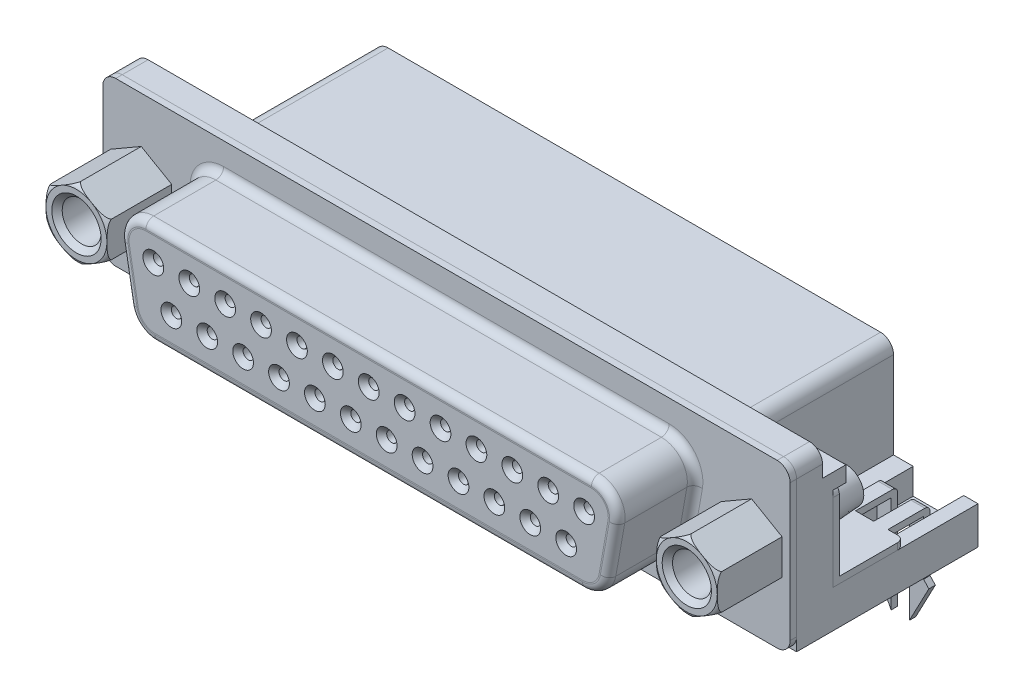
from build123d import *

# Parameters (mm, degrees)
EXTRUIR1_DEPTH         = 0.5
EXTRUIR2_DEPTH         = 6
CORTAR_EXTRUIR1_DEPTH  = 6
REDONDEO1_R            = 0.6
CROQUIS5_R             = 0.4
EXTRUIR3_DEPTH         = 6
CHAFL_N1_SIZE          = 0.4
CROQUIS6_R             = 1.6
CORTAR_EXTRUIR2_DEPTH  = 6
EXTRUIR4_DEPTH         = 5
CROQUIS9_R             = 1.5
CORTAR_EXTRUIR3_DEPTH  = 4
CHAFL_N2_SIZE          = 0.4
EXTRUIR5_DEPTH         = 14
CORTAR_EXTRUIR4_DEPTH  = 12
REDONDEO2_R            = 1
EXTRUIR6_DEPTH         = 53.04
CROQUIS13_W            = 3.9
CROQUIS13_H            = 13.996987952
CORTAR_EXTRUIR5_DEPTH  = 2
CROQUIS14_W            = 39.5
CROQUIS14_H            = 13.668273092
CORTAR_EXTRUIR6_DEPTH  = 0.6
EXTRUIR7_DEPTH         = 4.4
EXTRUIR7_DEPTH_BACK    = 2
CROQUIS15_W            = 0.7
CROQUIS15_H            = 0.7
EXTRUIR7_2_DEPTH       = 4.4
EXTRUIR7_2_DEPTH_BACK  = 2
EXTRUIR7_3_DEPTH       = 4.4
EXTRUIR7_3_DEPTH_BACK  = 2
EXTRUIR7_4_DEPTH       = 4.4
EXTRUIR7_4_DEPTH_BACK  = 2
EXTRUIR7_5_DEPTH       = 4.4
EXTRUIR7_5_DEPTH_BACK  = 2
EXTRUIR7_6_DEPTH       = 4.4
EXTRUIR7_6_DEPTH_BACK  = 2
EXTRUIR7_7_DEPTH       = 4.4
EXTRUIR7_7_DEPTH_BACK  = 2
EXTRUIR7_8_DEPTH       = 4.4
EXTRUIR7_8_DEPTH_BACK  = 2
EXTRUIR7_9_DEPTH       = 4.4
EXTRUIR7_9_DEPTH_BACK  = 2
EXTRUIR7_10_DEPTH      = 4.4
EXTRUIR7_10_DEPTH_BACK = 2
EXTRUIR7_11_DEPTH      = 4.4
EXTRUIR7_11_DEPTH_BACK = 2
EXTRUIR7_12_DEPTH      = 4.4
EXTRUIR7_12_DEPTH_BACK = 2
EXTRUIR7_13_DEPTH      = 4.4
EXTRUIR7_13_DEPTH_BACK = 2
EXTRUIR7_14_DEPTH      = 4.4
EXTRUIR7_14_DEPTH_BACK = 2
EXTRUIR7_15_DEPTH      = 4.4
EXTRUIR7_15_DEPTH_BACK = 2
EXTRUIR7_16_DEPTH      = 4.4
EXTRUIR7_16_DEPTH_BACK = 2
EXTRUIR7_17_DEPTH      = 4.4
EXTRUIR7_17_DEPTH_BACK = 2
EXTRUIR7_18_DEPTH      = 4.4
EXTRUIR7_18_DEPTH_BACK = 2
EXTRUIR7_19_DEPTH      = 4.4
EXTRUIR7_19_DEPTH_BACK = 2
EXTRUIR7_20_DEPTH      = 4.4
EXTRUIR7_20_DEPTH_BACK = 2
EXTRUIR7_21_DEPTH      = 4.4
EXTRUIR7_21_DEPTH_BACK = 2
EXTRUIR7_22_DEPTH      = 4.4
EXTRUIR7_22_DEPTH_BACK = 2
EXTRUIR7_23_DEPTH      = 4.4
EXTRUIR7_23_DEPTH_BACK = 2
EXTRUIR7_24_DEPTH      = 4.4
EXTRUIR7_24_DEPTH_BACK = 2
EXTRUIR7_25_DEPTH      = 4.4
EXTRUIR7_25_DEPTH_BACK = 2
CROQUIS16_W            = 0.7
CROQUIS16_H            = 4.035508996
CROQUIS16_H_2          = 6.875508996
CORTAR_EXTRUIR7_DEPTH  = 2
CORTAR_EXTRUIR9_DEPTH  = 4
EXTRUIR8_DEPTH         = 0.5
CROQUIS19_W            = 1.1
CROQUIS19_H            = 3.25
EXTRUIR9_DEPTH         = 0.5
REDONDEO3_R            = 0.4
EXTRUIR10_DEPTH        = 0.5
EXTRUIR10_2_DEPTH      = 0.5
REDONDEO4_R            = 0.4
CROQUIS21_R            = 1.6
EXTRUIR11_DEPTH        = 3.5
EXTRUIR11_TAPER        = 4
CROQUIS22_W            = 37
CROQUIS22_H            = 6
CROQUIS22_W_2          = 36.8
CROQUIS22_H_2          = 5.8
CORTAR_EXTRUIR10_DEPTH = 6.5


with BuildPart() as part:
    # Croquis1 → Extruir1 (new body)
    with BuildSketch(Plane.XY):
        with BuildLine():
            Line((-25.52, 6.275), (25.52, 6.275))
            ThreePointArc((25.52, 6.275), (26.227106781, 5.982106781), (26.52, 5.275))
            Line((26.52, 5.275), (26.52, -5.275))
            ThreePointArc((26.52, -5.275), (26.227106781, -5.982106781), (25.52, -6.275))
            Line((25.52, -6.275), (-25.52, -6.275))
            ThreePointArc((-25.52, -6.275), (-26.227106781, -5.982106781), (-26.52, -5.275))
            Line((-26.52, -5.275), (-26.52, 5.275))
            ThreePointArc((-26.52, 5.275), (-26.227106781, 5.982106781), (-25.52, 6.275))
        make_face()
    extrude(amount=EXTRUIR1_DEPTH)

    # Croquis2 → Extruir2 (add)
    with BuildSketch(Plane.XY.offset(0.5)):
        with BuildLine():
            Line((19.159615506, 1.602703645), (18.471940281, -2.297296355))
            ThreePointArc((18.471940281, -2.297296355), (17.787899995, -3.482088886), (16.502324775, -3.95))
            Line((16.502324775, -3.95), (-16.502324775, -3.95))
            ThreePointArc((-16.502324775, -3.95), (-17.787899995, -3.482088886), (-18.471940281, -2.297296355))
            Line((-18.471940281, -2.297296355), (-19.159615506, 1.602703645))
            ThreePointArc((-19.159615506, 1.602703645), (-18.722088886, 3.235575219), (-17.19, 3.95))
            Line((-17.19, 3.95), (17.19, 3.95))
            ThreePointArc((17.19, 3.95), (18.722088886, 3.235575219), (19.159615506, 1.602703645))
        make_face()
    extrude(amount=EXTRUIR2_DEPTH)

    # Croquis3 → Cortar-Extruir1 (cut)
    with BuildSketch(Plane.XY.offset(6.5)):
        with BuildLine():
            Line((17.19, 3.25), (-17.19, 3.25))
            ThreePointArc((-17.19, 3.25), (-18.185857776, 2.785623893), (-18.470250079, 1.724257369))
            Line((-18.470250079, 1.724257369), (-17.782574854, -2.175742631))
            ThreePointArc((-17.782574854, -2.175742631), (-17.337948668, -2.945857776), (-16.502324775, -3.25))
            Line((-16.502324775, -3.25), (16.502324775, -3.25))
            ThreePointArc((16.502324775, -3.25), (17.337948668, -2.945857776), (17.782574854, -2.175742631))
            Line((17.782574854, -2.175742631), (18.470250079, 1.724257369))
            ThreePointArc((18.470250079, 1.724257369), (18.185857776, 2.785623893), (17.19, 3.25))
        make_face()
    extrude(amount=-CORTAR_EXTRUIR1_DEPTH, mode=Mode.SUBTRACT)

    # Redondeo1
    redondeo1_edges = [part.edges().sort_by_distance(p)[0] for p in [
        (17.787899995, -3.482088886, 0.5),
        (18.815777894, -0.347296355, 0.5),
        (18.722088886, 3.235575219, 0.5),
        (0, 3.95, 0.5),
        (-18.722088886, 3.235575219, 0.5),
        (-18.815777894, -0.347296355, 0.5),
        (-17.787899995, -3.482088886, 0.5),
        (0, -3.95, 0.5),
        (17.787899995, -3.482088886, 6.5),
        (18.815777894, -0.347296355, 6.5),
        (18.722088886, 3.235575219, 6.5),
        (0, 3.95, 6.5),
        (-18.722088886, 3.235575219, 6.5),
        (-18.815777894, -0.347296355, 6.5),
        (-17.787899995, -3.482088886, 6.5),
        (0, -3.95, 6.5),
    ]]
    fillet(redondeo1_edges, radius=REDONDEO1_R)

    # Croquis6 → Cortar-Extruir2 (cut)
    with BuildSketch(Plane.XY.offset(0.5)):
        with Locations((23.55, 0)):
            Circle(CROQUIS6_R)
        with Locations((-23.55, 0)):
            Circle(CROQUIS6_R)
    extrude(amount=-CORTAR_EXTRUIR2_DEPTH, mode=Mode.SUBTRACT)


with BuildPart() as body_2:
    # Croquis5 → Extruir3 (new body)
    with BuildSketch(Plane.XY.offset(0.5)):
        with BuildLine():
            Line((17.19, 3.25), (-17.19, 3.25))
            ThreePointArc((-17.19, 3.25), (-18.185857776, 2.785623893), (-18.470250079, 1.724257369))
            Line((-18.470250079, 1.724257369), (-17.782574854, -2.175742631))
            ThreePointArc((-17.782574854, -2.175742631), (-17.337948668, -2.945857776), (-16.502324775, -3.25))
            Line((-16.502324775, -3.25), (16.502324775, -3.25))
            ThreePointArc((16.502324775, -3.25), (17.337948668, -2.945857776), (17.782574854, -2.175742631))
            Line((17.782574854, -2.175742631), (18.470250079, 1.724257369))
            ThreePointArc((18.470250079, 1.724257369), (18.185857776, 2.785623893), (17.19, 3.25))
        make_face()
        with Locations((16.625, 1.42)):
            Circle(CROQUIS5_R, mode=Mode.SUBTRACT)
        with Locations((13.855, 1.42)):
            Circle(CROQUIS5_R, mode=Mode.SUBTRACT)
        with Locations((11.085, 1.42)):
            Circle(CROQUIS5_R, mode=Mode.SUBTRACT)
        with Locations((8.315, 1.42)):
            Circle(CROQUIS5_R, mode=Mode.SUBTRACT)
        with Locations((5.545, 1.42)):
            Circle(CROQUIS5_R, mode=Mode.SUBTRACT)
        with Locations((2.775, 1.42)):
            Circle(CROQUIS5_R, mode=Mode.SUBTRACT)
        with Locations((0.005, 1.42)):
            Circle(CROQUIS5_R, mode=Mode.SUBTRACT)
        with Locations((-2.765, 1.42)):
            Circle(CROQUIS5_R, mode=Mode.SUBTRACT)
        with Locations((-5.535, 1.42)):
            Circle(CROQUIS5_R, mode=Mode.SUBTRACT)
        with Locations((-8.305, 1.42)):
            Circle(CROQUIS5_R, mode=Mode.SUBTRACT)
        with Locations((-11.075, 1.42)):
            Circle(CROQUIS5_R, mode=Mode.SUBTRACT)
        with Locations((-13.845, 1.42)):
            Circle(CROQUIS5_R, mode=Mode.SUBTRACT)
        with Locations((-16.615, 1.42)):
            Circle(CROQUIS5_R, mode=Mode.SUBTRACT)
        with Locations((15.24, -1.42)):
            Circle(CROQUIS5_R, mode=Mode.SUBTRACT)
        with Locations((12.47, -1.42)):
            Circle(CROQUIS5_R, mode=Mode.SUBTRACT)
        with Locations((9.7, -1.42)):
            Circle(CROQUIS5_R, mode=Mode.SUBTRACT)
        with Locations((6.93, -1.42)):
            Circle(CROQUIS5_R, mode=Mode.SUBTRACT)
        with Locations((4.16, -1.42)):
            Circle(CROQUIS5_R, mode=Mode.SUBTRACT)
        with Locations((1.39, -1.42)):
            Circle(CROQUIS5_R, mode=Mode.SUBTRACT)
        with Locations((-1.38, -1.42)):
            Circle(CROQUIS5_R, mode=Mode.SUBTRACT)
        with Locations((-4.15, -1.42)):
            Circle(CROQUIS5_R, mode=Mode.SUBTRACT)
        with Locations((-6.92, -1.42)):
            Circle(CROQUIS5_R, mode=Mode.SUBTRACT)
        with Locations((-9.69, -1.42)):
            Circle(CROQUIS5_R, mode=Mode.SUBTRACT)
        with Locations((-12.46, -1.42)):
            Circle(CROQUIS5_R, mode=Mode.SUBTRACT)
        with Locations((-15.23, -1.42)):
            Circle(CROQUIS5_R, mode=Mode.SUBTRACT)
    extrude(amount=EXTRUIR3_DEPTH)

    # Chaflán1
    chafl_n1_edges = [body_2.edges().sort_by_distance(p)[0] for p in [
        (-7.32, -1.42, 6.5),
        (-10.09, -1.42, 6.5),
        (-12.86, -1.42, 6.5),
        (-15.63, -1.42, 6.5),
        (16.225, 1.42, 6.5),
        (13.455, 1.42, 6.5),
        (10.685, 1.42, 6.5),
        (7.915, 1.42, 6.5),
        (5.145, 1.42, 6.5),
        (2.375, 1.42, 6.5),
        (-0.395, 1.42, 6.5),
        (-3.165, 1.42, 6.5),
        (-5.935, 1.42, 6.5),
        (-8.705, 1.42, 6.5),
        (-11.475, 1.42, 6.5),
        (-14.245, 1.42, 6.5),
        (-17.015, 1.42, 6.5),
        (14.84, -1.42, 6.5),
        (12.07, -1.42, 6.5),
        (9.3, -1.42, 6.5),
        (6.53, -1.42, 6.5),
        (3.76, -1.42, 6.5),
        (0.99, -1.42, 6.5),
        (-1.78, -1.42, 6.5),
        (-4.55, -1.42, 6.5),
    ]]
    chamfer(chafl_n1_edges, length=CHAFL_N1_SIZE)


with BuildPart() as body_3:
    # Croquis7 → Extruir4 (new body)
    with BuildSketch(Plane.XY.offset(0.5)):
        Polygon((23.55, 2.713546265), (21.2, 1.356773133), (21.2, -1.356773133), (23.55, -2.713546265), (25.9, -1.356773133), (25.9, 1.356773133), align=None)
    extrude(amount=EXTRUIR4_DEPTH)

    # Croquis8 → Cortar-Revolución1 (revolve, cut)
    with BuildSketch(Plane(origin=(23.55, 0, 0), x_dir=(0, 0, -1), z_dir=(1, 0, 0))):
        with BuildLine():
            Line((-5.162976237, 2.713546265), (-5.162976237, 5.085332436))
            Line((-5.162976237, 5.085332436), (-6.486384623, 5.085332436))
            Line((-6.486384623, 5.085332436), (-6.187801984, 2.35))
            Line((-6.187801984, 2.35), (-5.5, 2.35))
            ThreePointArc((-5.5, 2.35), (-5.375308528, 2.572396625), (-5.162976237, 2.713546265))
        make_face()
    revolve(axis=Axis((23.55, 0, 0), (0, 0, -1)), mode=Mode.SUBTRACT)

    # Croquis9 → Cortar-Extruir3 (cut)
    with BuildSketch(Plane.XY.offset(5.5)):
        with Locations((23.55, 0)):
            Circle(CROQUIS9_R)
    extrude(amount=-CORTAR_EXTRUIR3_DEPTH, mode=Mode.SUBTRACT)

    # Chaflán2
    chafl_n2_edges = [body_3.edges().sort_by_distance(p)[0] for p in [
        (22.05, 0, 5.5),
    ]]
    chamfer(chafl_n2_edges, length=CHAFL_N2_SIZE)


with BuildPart() as body_4:
    # Simetría1: mirrored copy
    add(body_3.part.mirror(Plane(origin=(0, 0, 0), x_dir=(0, 0, 1), z_dir=(1, 0, 0))))


with BuildPart() as body_5:
    # Croquis10 → Extruir5 (new body)
    with BuildSketch(Plane(origin=(0, 0, 0), x_dir=(-1, 0, 0), z_dir=(0, 0, -1))):
        with BuildLine():
            Line((-25.52, 6.275), (25.52, 6.275))
            ThreePointArc((25.52, 6.275), (26.227106781, 5.982106781), (26.52, 5.275))
            Line((26.52, 5.275), (26.52, -6.275))
            Line((26.52, -6.275), (-26.52, -6.275))
            Line((-26.52, -6.275), (-26.52, 5.275))
            ThreePointArc((-26.52, 5.275), (-26.227106781, 5.982106781), (-25.52, 6.275))
        make_face()
    extrude(amount=EXTRUIR5_DEPTH)

    # Croquis11 → Cortar-Extruir4 (cut)
    with BuildSketch(Plane(origin=(0, 0, -14), x_dir=(-1, 0, 0), z_dir=(0, 0, -1))):
        Polygon((30.029317269, -3.375), (20, -3.375), (20, 4.325), (-20, 4.325), (-20, -3.375), (-30.65060241, -3.375), (-30.65060241, 10.825803213), (30.029317269, 10.825803213), align=None)
    extrude(amount=-CORTAR_EXTRUIR4_DEPTH, mode=Mode.SUBTRACT)

    # Redondeo2
    redondeo2_edges = [body_5.edges().sort_by_distance(p)[0] for p in [
        (-20, 4.325, -8),
        (20, 4.325, -8),
    ]]
    fillet(redondeo2_edges, radius=REDONDEO2_R)


with BuildPart() as body_6:
    # Croquis12 → Extruir6 (new body)
    with BuildSketch(Plane(origin=(26.52, 0, 0), x_dir=(0, 0, -1), z_dir=(1, 0, 0))):
        Polygon((2, 4.325), (3.8, 4.325), (3.8, 3.125), (2.8, 3.125), (2.8, -3.375), (2, -3.375), align=None)
    extrude(amount=-EXTRUIR6_DEPTH)


with BuildPart() as body_5_1:
    add(body_5.part)

    # Combinar1: union body 6
    add(body_6.part)

    # Croquis13 → Cortar-Extruir5 (cut)
    with BuildSketch(Plane(origin=(0, -3.375, 0), x_dir=(-1, 0, 0), z_dir=(0, 1, 0))):
        with Locations((-23.47, -9.798493976)):
            Rectangle(CROQUIS13_W, CROQUIS13_H)
        with Locations((23.47, -9.798493976)):
            Rectangle(CROQUIS13_W, CROQUIS13_H)
    extrude(amount=-CORTAR_EXTRUIR5_DEPTH, mode=Mode.SUBTRACT)

    # Croquis14 → Cortar-Extruir6 (cut)
    with BuildSketch(Plane.XZ.offset(6.275)):
        with Locations((0, -8.834136546)):
            Rectangle(CROQUIS14_W, CROQUIS14_H)
    extrude(amount=-CORTAR_EXTRUIR6_DEPTH, mode=Mode.SUBTRACT)

    # Croquis16 → Cortar-Extruir7 (cut)
    with BuildSketch(Plane.XZ.offset(5.675)):
        with Locations((16.625, -14.017754498)):
            Rectangle(CROQUIS16_W, CROQUIS16_H)
        with Locations((13.855, -14.017754498)):
            Rectangle(CROQUIS16_W, CROQUIS16_H)
        with Locations((15.24, -12.597754498)):
            Rectangle(CROQUIS16_W, CROQUIS16_H_2)
        with Locations((12.47, -12.597754498)):
            Rectangle(CROQUIS16_W, CROQUIS16_H_2)
        with Locations((11.085, -14.017754498)):
            Rectangle(CROQUIS16_W, CROQUIS16_H)
        with Locations((9.7, -12.597754498)):
            Rectangle(CROQUIS16_W, CROQUIS16_H_2)
        with Locations((8.315, -14.017754498)):
            Rectangle(CROQUIS16_W, CROQUIS16_H)
        with Locations((6.93, -12.597754498)):
            Rectangle(CROQUIS16_W, CROQUIS16_H_2)
        with Locations((5.545, -14.017754498)):
            Rectangle(CROQUIS16_W, CROQUIS16_H)
        with Locations((4.16, -12.597754498)):
            Rectangle(CROQUIS16_W, CROQUIS16_H_2)
        with Locations((2.775, -14.017754498)):
            Rectangle(CROQUIS16_W, CROQUIS16_H)
        with Locations((1.39, -12.597754498)):
            Rectangle(CROQUIS16_W, CROQUIS16_H_2)
        with Locations((0.005, -14.017754498)):
            Rectangle(CROQUIS16_W, CROQUIS16_H)
        with Locations((-1.38, -12.597754498)):
            Rectangle(CROQUIS16_W, CROQUIS16_H_2)
        with Locations((-2.765, -14.017754498)):
            Rectangle(CROQUIS16_W, CROQUIS16_H)
        with Locations((-4.15, -12.597754498)):
            Rectangle(CROQUIS16_W, CROQUIS16_H_2)
        with Locations((-5.535, -14.017754498)):
            Rectangle(CROQUIS16_W, CROQUIS16_H)
        with Locations((-6.92, -12.597754498)):
            Rectangle(CROQUIS16_W, CROQUIS16_H_2)
        with Locations((-8.305, -14.017754498)):
            Rectangle(CROQUIS16_W, CROQUIS16_H)
        with Locations((-9.69, -12.597754498)):
            Rectangle(CROQUIS16_W, CROQUIS16_H_2)
        with Locations((-11.075, -14.017754498)):
            Rectangle(CROQUIS16_W, CROQUIS16_H)
        with Locations((-12.46, -12.597754498)):
            Rectangle(CROQUIS16_W, CROQUIS16_H_2)
        with Locations((-13.845, -14.017754498)):
            Rectangle(CROQUIS16_W, CROQUIS16_H)
        with Locations((-15.23, -12.597754498)):
            Rectangle(CROQUIS16_W, CROQUIS16_H_2)
        with Locations((-16.615, -14.017754498)):
            Rectangle(CROQUIS16_W, CROQUIS16_H)
    extrude(amount=-CORTAR_EXTRUIR7_DEPTH, mode=Mode.SUBTRACT)

    # Croquis17 → Cortar-Extruir9 (cut)
    with BuildSketch(Plane(origin=(0, -5.375, 0), x_dir=(-1, 0, 0), z_dir=(0, 1, 0))):
        with BuildLine():
            Line((-21.52, -9.3), (-21.52, -11.3))
            ThreePointArc((-21.52, -11.3), (-23.47, -13.25), (-25.42, -11.3))
            Line((-25.42, -11.3), (-25.42, -9.3))
            ThreePointArc((-25.42, -9.3), (-23.47, -7.35), (-21.52, -9.3))
        make_face()
        with BuildLine():
            Line((25.42, -9.3), (25.42, -11.3))
            ThreePointArc((25.42, -11.3), (23.47, -13.25), (21.52, -11.3))
            Line((21.52, -11.3), (21.52, -9.3))
            ThreePointArc((21.52, -9.3), (23.47, -7.35), (25.42, -9.3))
        make_face()
    extrude(amount=-CORTAR_EXTRUIR9_DEPTH, mode=Mode.SUBTRACT)

    # Redondeo3
    redondeo3_edges = [body_5_1.edges().sort_by_distance(p)[0] for p in [
        (25.97, -3.375, -2.8),
    ]]
    fillet(redondeo3_edges, radius=REDONDEO3_R)

    # Croquis22 → Cortar-Extruir10 (cut)
    with BuildSketch(Plane(origin=(0, 0, -14), x_dir=(-1, 0, 0), z_dir=(0, 0, -1))):
        with Locations((0, -0.675)):
            Rectangle(CROQUIS22_W, CROQUIS22_H)
        with Locations((0, -0.675)):
            Rectangle(CROQUIS22_W_2, CROQUIS22_H_2, mode=Mode.SUBTRACT)
    extrude(amount=-CORTAR_EXTRUIR10_DEPTH, mode=Mode.SUBTRACT)


with BuildPart() as body_6_2:
    # Croquis15 → Extruir7 (new, two sides: drawn at the far end of the back side and taken through both)
    with BuildSketch(Plane.XZ.offset(5.675).offset(-EXTRUIR7_DEPTH_BACK)):
        with Locations((16.625, -12.35)):
            Rectangle(CROQUIS15_W, CROQUIS15_H)
    extrude(amount=EXTRUIR7_DEPTH + EXTRUIR7_DEPTH_BACK)


with BuildPart() as body_7:
    # Croquis15 → Extruir7 2 (new, two sides: drawn at the far end of the back side and taken through both)
    with BuildSketch(Plane.XZ.offset(5.675).offset(-EXTRUIR7_2_DEPTH_BACK)):
        with Locations((13.855, -12.35)):
            Rectangle(CROQUIS15_W, CROQUIS15_H)
    extrude(amount=EXTRUIR7_2_DEPTH + EXTRUIR7_2_DEPTH_BACK)


with BuildPart() as body_8:
    # Croquis15 → Extruir7 3 (new, two sides: drawn at the far end of the back side and taken through both)
    with BuildSketch(Plane.XZ.offset(5.675).offset(-EXTRUIR7_3_DEPTH_BACK)):
        with Locations((11.085, -12.35)):
            Rectangle(CROQUIS15_W, CROQUIS15_H)
    extrude(amount=EXTRUIR7_3_DEPTH + EXTRUIR7_3_DEPTH_BACK)


with BuildPart() as body_9:
    # Croquis15 → Extruir7 4 (new, two sides: drawn at the far end of the back side and taken through both)
    with BuildSketch(Plane.XZ.offset(5.675).offset(-EXTRUIR7_4_DEPTH_BACK)):
        with Locations((8.315, -12.35)):
            Rectangle(CROQUIS15_W, CROQUIS15_H)
    extrude(amount=EXTRUIR7_4_DEPTH + EXTRUIR7_4_DEPTH_BACK)


with BuildPart() as body_10:
    # Croquis15 → Extruir7 5 (new, two sides: drawn at the far end of the back side and taken through both)
    with BuildSketch(Plane.XZ.offset(5.675).offset(-EXTRUIR7_5_DEPTH_BACK)):
        with Locations((5.545, -12.35)):
            Rectangle(CROQUIS15_W, CROQUIS15_H)
    extrude(amount=EXTRUIR7_5_DEPTH + EXTRUIR7_5_DEPTH_BACK)


with BuildPart() as body_11:
    # Croquis15 → Extruir7 6 (new, two sides: drawn at the far end of the back side and taken through both)
    with BuildSketch(Plane.XZ.offset(5.675).offset(-EXTRUIR7_6_DEPTH_BACK)):
        with Locations((2.775, -12.35)):
            Rectangle(CROQUIS15_W, CROQUIS15_H)
    extrude(amount=EXTRUIR7_6_DEPTH + EXTRUIR7_6_DEPTH_BACK)


with BuildPart() as body_12:
    # Croquis15 → Extruir7 7 (new, two sides: drawn at the far end of the back side and taken through both)
    with BuildSketch(Plane.XZ.offset(5.675).offset(-EXTRUIR7_7_DEPTH_BACK)):
        with Locations((0.005, -12.35)):
            Rectangle(CROQUIS15_W, CROQUIS15_H)
    extrude(amount=EXTRUIR7_7_DEPTH + EXTRUIR7_7_DEPTH_BACK)


with BuildPart() as body_13:
    # Croquis15 → Extruir7 8 (new, two sides: drawn at the far end of the back side and taken through both)
    with BuildSketch(Plane.XZ.offset(5.675).offset(-EXTRUIR7_8_DEPTH_BACK)):
        with Locations((-2.765, -12.35)):
            Rectangle(CROQUIS15_W, CROQUIS15_H)
    extrude(amount=EXTRUIR7_8_DEPTH + EXTRUIR7_8_DEPTH_BACK)


with BuildPart() as body_14:
    # Croquis15 → Extruir7 9 (new, two sides: drawn at the far end of the back side and taken through both)
    with BuildSketch(Plane.XZ.offset(5.675).offset(-EXTRUIR7_9_DEPTH_BACK)):
        with Locations((-5.535, -12.35)):
            Rectangle(CROQUIS15_W, CROQUIS15_H)
    extrude(amount=EXTRUIR7_9_DEPTH + EXTRUIR7_9_DEPTH_BACK)


with BuildPart() as body_15:
    # Croquis15 → Extruir7 10 (new, two sides: drawn at the far end of the back side and taken through both)
    with BuildSketch(Plane.XZ.offset(5.675).offset(-EXTRUIR7_10_DEPTH_BACK)):
        with Locations((-8.305, -12.35)):
            Rectangle(CROQUIS15_W, CROQUIS15_H)
    extrude(amount=EXTRUIR7_10_DEPTH + EXTRUIR7_10_DEPTH_BACK)


with BuildPart() as body_16:
    # Croquis15 → Extruir7 11 (new, two sides: drawn at the far end of the back side and taken through both)
    with BuildSketch(Plane.XZ.offset(5.675).offset(-EXTRUIR7_11_DEPTH_BACK)):
        with Locations((-11.075, -12.35)):
            Rectangle(CROQUIS15_W, CROQUIS15_H)
    extrude(amount=EXTRUIR7_11_DEPTH + EXTRUIR7_11_DEPTH_BACK)


with BuildPart() as body_17:
    # Croquis15 → Extruir7 12 (new, two sides: drawn at the far end of the back side and taken through both)
    with BuildSketch(Plane.XZ.offset(5.675).offset(-EXTRUIR7_12_DEPTH_BACK)):
        with Locations((-13.845, -12.35)):
            Rectangle(CROQUIS15_W, CROQUIS15_H)
    extrude(amount=EXTRUIR7_12_DEPTH + EXTRUIR7_12_DEPTH_BACK)


with BuildPart() as body_18:
    # Croquis15 → Extruir7 13 (new, two sides: drawn at the far end of the back side and taken through both)
    with BuildSketch(Plane.XZ.offset(5.675).offset(-EXTRUIR7_13_DEPTH_BACK)):
        with Locations((-16.615, -12.35)):
            Rectangle(CROQUIS15_W, CROQUIS15_H)
    extrude(amount=EXTRUIR7_13_DEPTH + EXTRUIR7_13_DEPTH_BACK)


with BuildPart() as body_19:
    # Croquis15 → Extruir7 14 (new, two sides: drawn at the far end of the back side and taken through both)
    with BuildSketch(Plane.XZ.offset(5.675).offset(-EXTRUIR7_14_DEPTH_BACK)):
        with Locations((15.24, -9.51)):
            Rectangle(CROQUIS15_W, CROQUIS15_H)
    extrude(amount=EXTRUIR7_14_DEPTH + EXTRUIR7_14_DEPTH_BACK)


with BuildPart() as body_20:
    # Croquis15 → Extruir7 15 (new, two sides: drawn at the far end of the back side and taken through both)
    with BuildSketch(Plane.XZ.offset(5.675).offset(-EXTRUIR7_15_DEPTH_BACK)):
        with Locations((12.47, -9.51)):
            Rectangle(CROQUIS15_W, CROQUIS15_H)
    extrude(amount=EXTRUIR7_15_DEPTH + EXTRUIR7_15_DEPTH_BACK)


with BuildPart() as body_21:
    # Croquis15 → Extruir7 16 (new, two sides: drawn at the far end of the back side and taken through both)
    with BuildSketch(Plane.XZ.offset(5.675).offset(-EXTRUIR7_16_DEPTH_BACK)):
        with Locations((9.7, -9.51)):
            Rectangle(CROQUIS15_W, CROQUIS15_H)
    extrude(amount=EXTRUIR7_16_DEPTH + EXTRUIR7_16_DEPTH_BACK)


with BuildPart() as body_22:
    # Croquis15 → Extruir7 17 (new, two sides: drawn at the far end of the back side and taken through both)
    with BuildSketch(Plane.XZ.offset(5.675).offset(-EXTRUIR7_17_DEPTH_BACK)):
        with Locations((6.93, -9.51)):
            Rectangle(CROQUIS15_W, CROQUIS15_H)
    extrude(amount=EXTRUIR7_17_DEPTH + EXTRUIR7_17_DEPTH_BACK)


with BuildPart() as body_23:
    # Croquis15 → Extruir7 18 (new, two sides: drawn at the far end of the back side and taken through both)
    with BuildSketch(Plane.XZ.offset(5.675).offset(-EXTRUIR7_18_DEPTH_BACK)):
        with Locations((4.16, -9.51)):
            Rectangle(CROQUIS15_W, CROQUIS15_H)
    extrude(amount=EXTRUIR7_18_DEPTH + EXTRUIR7_18_DEPTH_BACK)


with BuildPart() as body_24:
    # Croquis15 → Extruir7 19 (new, two sides: drawn at the far end of the back side and taken through both)
    with BuildSketch(Plane.XZ.offset(5.675).offset(-EXTRUIR7_19_DEPTH_BACK)):
        with Locations((1.39, -9.51)):
            Rectangle(CROQUIS15_W, CROQUIS15_H)
    extrude(amount=EXTRUIR7_19_DEPTH + EXTRUIR7_19_DEPTH_BACK)


with BuildPart() as body_25:
    # Croquis15 → Extruir7 20 (new, two sides: drawn at the far end of the back side and taken through both)
    with BuildSketch(Plane.XZ.offset(5.675).offset(-EXTRUIR7_20_DEPTH_BACK)):
        with Locations((-1.38, -9.51)):
            Rectangle(CROQUIS15_W, CROQUIS15_H)
    extrude(amount=EXTRUIR7_20_DEPTH + EXTRUIR7_20_DEPTH_BACK)


with BuildPart() as body_26:
    # Croquis15 → Extruir7 21 (new, two sides: drawn at the far end of the back side and taken through both)
    with BuildSketch(Plane.XZ.offset(5.675).offset(-EXTRUIR7_21_DEPTH_BACK)):
        with Locations((-4.15, -9.51)):
            Rectangle(CROQUIS15_W, CROQUIS15_H)
    extrude(amount=EXTRUIR7_21_DEPTH + EXTRUIR7_21_DEPTH_BACK)


with BuildPart() as body_27:
    # Croquis15 → Extruir7 22 (new, two sides: drawn at the far end of the back side and taken through both)
    with BuildSketch(Plane.XZ.offset(5.675).offset(-EXTRUIR7_22_DEPTH_BACK)):
        with Locations((-6.92, -9.51)):
            Rectangle(CROQUIS15_W, CROQUIS15_H)
    extrude(amount=EXTRUIR7_22_DEPTH + EXTRUIR7_22_DEPTH_BACK)


with BuildPart() as body_28:
    # Croquis15 → Extruir7 23 (new, two sides: drawn at the far end of the back side and taken through both)
    with BuildSketch(Plane.XZ.offset(5.675).offset(-EXTRUIR7_23_DEPTH_BACK)):
        with Locations((-9.69, -9.51)):
            Rectangle(CROQUIS15_W, CROQUIS15_H)
    extrude(amount=EXTRUIR7_23_DEPTH + EXTRUIR7_23_DEPTH_BACK)


with BuildPart() as body_29:
    # Croquis15 → Extruir7 24 (new, two sides: drawn at the far end of the back side and taken through both)
    with BuildSketch(Plane.XZ.offset(5.675).offset(-EXTRUIR7_24_DEPTH_BACK)):
        with Locations((-12.46, -9.51)):
            Rectangle(CROQUIS15_W, CROQUIS15_H)
    extrude(amount=EXTRUIR7_24_DEPTH + EXTRUIR7_24_DEPTH_BACK)


with BuildPart() as body_30:
    # Croquis15 → Extruir7 25 (new, two sides: drawn at the far end of the back side and taken through both)
    with BuildSketch(Plane.XZ.offset(5.675).offset(-EXTRUIR7_25_DEPTH_BACK)):
        with Locations((-15.23, -9.51)):
            Rectangle(CROQUIS15_W, CROQUIS15_H)
    extrude(amount=EXTRUIR7_25_DEPTH + EXTRUIR7_25_DEPTH_BACK)


with BuildPart() as body_31:
    # Croquis18 → Extruir8 (new body)
    with BuildSketch(Plane(origin=(0, 0, -2.8), x_dir=(-1, 0, 0), z_dir=(0, 0, -1))):
        with BuildLine():
            Line((-26.02, 3.125), (-21.022352261, 3.125))
            ThreePointArc((-21.022352261, 3.125), (-20.66879887, 2.978553391), (-20.522352261, 2.625))
            Line((-20.522352261, 2.625), (-20.522352261, -3.375))
            Line((-20.522352261, -3.375), (-26.52, -3.375))
            Line((-26.52, -3.375), (-26.52, 2.625))
            ThreePointArc((-26.52, 2.625), (-26.373553391, 2.978553391), (-26.02, 3.125))
        make_face()
    extrude(amount=EXTRUIR8_DEPTH)


with BuildPart() as body_32:
    # Croquis19 → Extruir9 (new body)
    with BuildSketch(Plane(origin=(0, -3.375, 0), x_dir=(-1, 0, 0), z_dir=(0, 1, 0))):
        with BuildLine():
            Line((-20.522352261, -7.8), (-20.522352261, -3.3))
            Line((-20.522352261, -3.3), (-25.42, -3.3))
            Line((-25.42, -3.3), (-25.42, -8.3))
            Line((-25.42, -8.3), (-25.27, -8.3))
            Line((-25.27, -8.3), (-25.27, -11.55))
            Line((-25.27, -11.55), (-24.17, -11.55))
            Line((-24.17, -11.55), (-24.17, -8.3))
            Line((-24.17, -8.3), (-22.77, -8.3))
            Line((-22.77, -8.3), (-21.67, -8.3))
            Line((-21.67, -8.3), (-21.022352261, -8.3))
            ThreePointArc((-21.022352261, -8.3), (-20.66879887, -8.153553391), (-20.522352261, -7.8))
        make_face()
        with BuildLine():
            Line((-25.42, -8.3), (-25.42, -3.3))
            Line((-25.42, -3.3), (-26.52, -3.3))
            Line((-26.52, -3.3), (-26.52, -7.8))
            ThreePointArc((-26.52, -7.8), (-26.373553391, -8.153553391), (-26.02, -8.3))
            Line((-26.02, -8.3), (-25.42, -8.3))
        make_face()
        with Locations((-22.22, -9.925)):
            Rectangle(CROQUIS19_W, CROQUIS19_H)
    extrude(amount=EXTRUIR9_DEPTH)


with BuildPart() as body_31_1:
    add(body_31.part)

    # Combinar2: union body 32
    add(body_32.part)


with BuildPart() as body_32_2:
    # Croquis20 → Extruir10 (new body)
    with BuildSketch(Plane(origin=(0, 0, -11.55), x_dir=(-1, 0, 0), z_dir=(0, 0, -1))):
        Polygon((-25.27, -3.375), (-25.27, -7.572082934), (-25.677453859, -8.013039481), (-24.17, -10.875), (-24.17, -3.375), align=None)
    extrude(amount=-EXTRUIR10_DEPTH)


with BuildPart() as body_33:
    # Croquis20 → Extruir10 2 (new body)
    with BuildSketch(Plane(origin=(0, 0, -11.55), x_dir=(-1, 0, 0), z_dir=(0, 0, -1))):
        Polygon((-22.77, -3.375), (-21.67, -3.375), (-21.67, -7.572082934), (-21.262546141, -8.013039481), (-22.77, -10.875), align=None)
    extrude(amount=-EXTRUIR10_2_DEPTH)


with BuildPart() as body_32_2_1:
    add(body_32_2.part)

    # Combinar3: union body 33, body 31
    add(body_33.part)
    add(body_31_1.part)

    # Redondeo4
    redondeo4_edges = [body_32_2_1.edges().sort_by_distance(p)[0] for p in [
        (24.72, -2.875, -11.55),
        (22.22, -2.875, -11.55),
    ]]
    fillet(redondeo4_edges, radius=REDONDEO4_R)


with BuildPart() as body_32_3:
    # Croquis21 → Extruir11 (new body)
    with BuildSketch(Plane(origin=(0, 0, -3.3), x_dir=(-1, 0, 0), z_dir=(0, 0, -1))):
        with Locations(Location((-23.55, 0, 0), (0, 0, 180))):
            Circle(CROQUIS21_R)
    extrude(amount=EXTRUIR11_DEPTH, taper=EXTRUIR11_TAPER)


with BuildPart() as body_33_2:
    # Simetría2: mirrored copy
    add(body_32_3.part.mirror(Plane(origin=(0, 0, 0), x_dir=(0, 0, 1), z_dir=(1, 0, 0))))


with BuildPart() as body_34:
    # Simetr_a2 2: mirrored copy
    add(body_32_2_1.part.mirror(Plane(origin=(0, 0, 0), x_dir=(0, 0, 1), z_dir=(1, 0, 0))))


solid = Compound([part.part, body_2.part, body_3.part, body_4.part, body_5_1.part, body_6_2.part, body_7.part, body_8.part, body_9.part, body_10.part, body_11.part, body_12.part, body_13.part, body_14.part, body_15.part, body_16.part, body_17.part, body_18.part, body_19.part, body_20.part, body_21.part, body_22.part, body_23.part, body_24.part, body_25.part, body_26.part, body_27.part, body_28.part, body_29.part, body_30.part, body_32_2_1.part, body_32_3.part, body_33_2.part, body_34.part])
